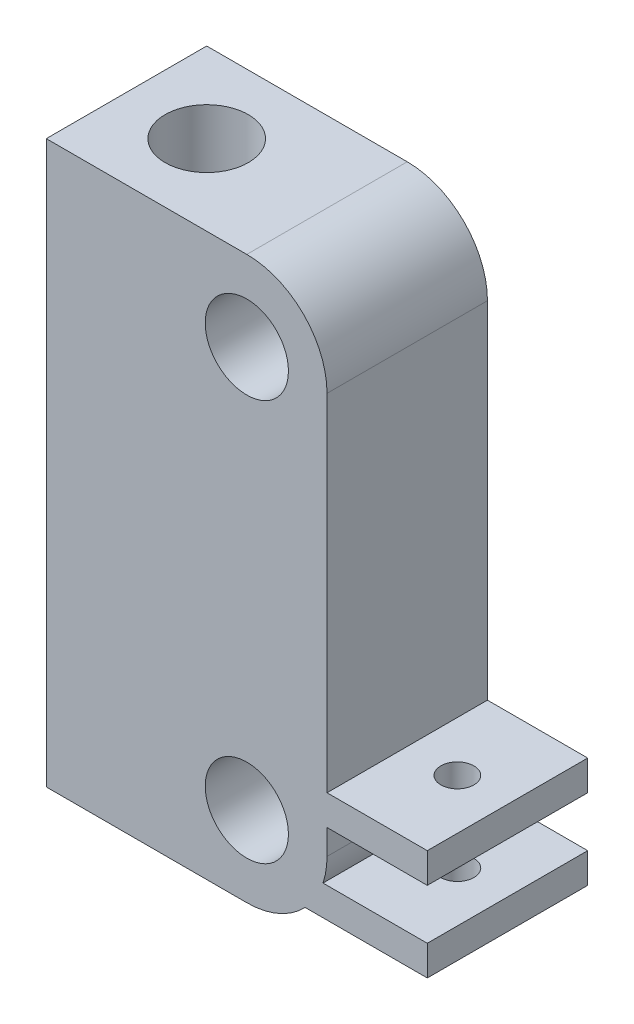
from build123d import *

# Parameters (mm, degrees)
SKETCH1_R           = 4.15
BOSS_EXTRUDE1_DEPTH = 16
SKETCH2_R           = 4.15
CUT_EXTRUDE1_DEPTH  = 63.237043653
SKETCH3_R           = 1.65
CUT_EXTRUDE2_DEPTH  = 51.435102881


with BuildPart() as part:
    # Sketch1 → Boss-Extrude1 (new body)
    with BuildSketch(Plane.XY):
        with BuildLine():
            Line((11.941959863, -20.868835105), (21.941959863, -20.868835105))
            Line((21.941959863, -20.868835105), (21.941959863, -23.868835105))
            Line((21.941959863, -23.868835105), (11.941959863, -23.868835105))
            Line((11.941959863, -23.868835105), (11.941959863, -26.368835105))
            ThreePointArc((11.941959863, -26.368835105), (11.841160348, -27.63478601), (11.541301939, -28.868835105))
            Line((11.541301939, -28.868835105), (21.941959863, -28.868835105))
            Line((21.941959863, -28.868835105), (21.941959863, -31.868835105))
            Line((21.941959863, -31.868835105), (9.751434882, -31.868835105))
            ThreePointArc((9.751434882, -31.868835105), (7.104237523, -33.717304334), (3.941959863, -34.368835105))
            Line((3.941959863, -34.368835105), (-16.058040137, -34.368835105))
            Line((-16.058040137, -34.368835105), (-16.058040137, 21.631164895))
            Line((-16.058040137, 21.631164895), (3.941959863, 21.631164895))
            ThreePointArc((3.941959863, 21.631164895), (9.598814112, 19.288019144), (11.941959863, 13.631164895))
            Line((11.941959863, 13.631164895), (11.941959863, -20.868835105))
        make_face()
        with Locations((3.941959863, 13.631164895)):
            Circle(SKETCH1_R, mode=Mode.SUBTRACT)
        with Locations((3.941959863, -26.368835105)):
            Circle(SKETCH1_R, mode=Mode.SUBTRACT)
    extrude(amount=-BOSS_EXTRUDE1_DEPTH)

    # Sketch2 → Cut-Extrude1 (cut, through all)
    with BuildSketch(Plane(origin=(0, 21.631164895, 0), x_dir=(1, 0, 0), z_dir=(0, 1, 0))):
        with Locations((-8.058040137, 8)):
            Circle(SKETCH2_R)
    extrude(amount=-CUT_EXTRUDE1_DEPTH, mode=Mode.SUBTRACT)

    # Sketch3 → Cut-Extrude2 (cut, through all)
    with BuildSketch(Plane(origin=(0, -20.868835105, 0), x_dir=(1, 0, 0), z_dir=(0, 1, 0))):
        with Locations((16.941959863, 8)):
            Circle(SKETCH3_R)
    extrude(amount=-CUT_EXTRUDE2_DEPTH, mode=Mode.SUBTRACT)


solid = part.part
